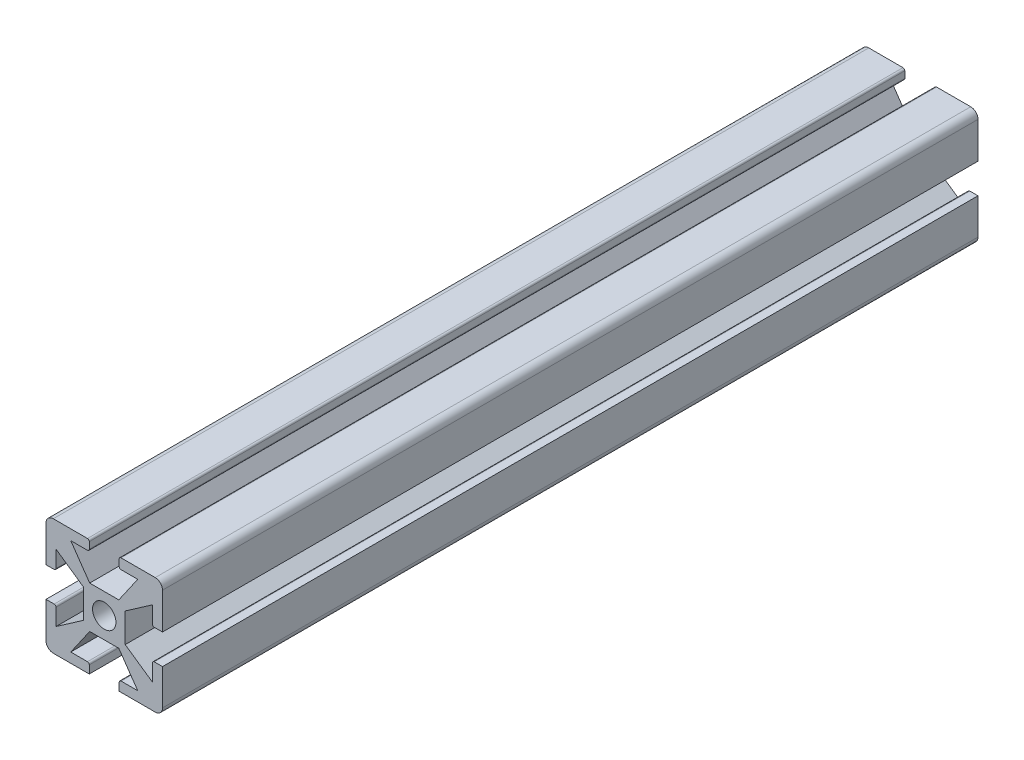
from build123d import *

# Parameters (mm, degrees)
SKETCH1_W           = 25.4
SKETCH1_H           = 25.4
BOSS_EXTRUDE1_DEPTH = 177.8
FILLET1_R           = 1.5875
HOLE1_OUTLINE_R     = 2.5527
HOLE1_DEPTH         = 177.8
SKETCH7_W           = 6.5278
SKETCH7_H           = 2.2352
CUT_EXTRUDE2_DEPTH  = 177.8
FILLET4_R           = 0.396875
CIRPATTERN2_DEPTH   = 177.8


# Read off the part's stored shape, not the designer's step: Hole1, CirPattern2
with BuildPart() as part:
    # Sketch1 → Boss-Extrude1 (new body)
    with BuildSketch(Plane.XY):
        Rectangle(SKETCH1_W, SKETCH1_H)
    extrude(amount=BOSS_EXTRUDE1_DEPTH)

    # Fillet1
    fillet1_edges = [part.edges().sort_by_distance(p)[0] for p in [
        (12.7, -12.7, 88.9),
        (-12.7, -12.7, 88.9),
        (-12.7, 12.7, 88.9),
        (12.7, 12.7, 88.9),
    ]]
    fillet(fillet1_edges, radius=FILLET1_R)

    # Hole1 outline → Hole1 (cut)
    with BuildSketch(Plane.XY):
        with Locations((0, -0.048792482)):
            Circle(HOLE1_OUTLINE_R)
    extrude(amount=HOLE1_DEPTH, mode=Mode.SUBTRACT)

    # Sketch7 → Cut-Extrude2 (cut)
    with BuildSketch(Plane.XY.offset(177.8)):
        with Locations((0, 11.5824)):
            Rectangle(SKETCH7_W, SKETCH7_H)
        Polygon((-3.175, 4.5212), (-7.3025, 10.4648), (7.3025, 10.4648), (3.175, 4.5212), align=None)
    extrude(amount=-CUT_EXTRUDE2_DEPTH, mode=Mode.SUBTRACT)

    # Fillet4
    fillet4_edges = [part.edges().sort_by_distance(p)[0] for p in [
        (-3.2639, 10.4648, 88.9),
        (-3.2639, 12.7, 88.9),
        (3.2639, 12.7, 88.9),
        (3.2639, 10.4648, 88.9),
    ]]
    fillet(fillet4_edges, radius=FILLET4_R)

    # CirPattern2 outline → CirPattern2 (cut)
    with BuildSketch(Plane.XY):
        with BuildLine():
            ThreePointArc((-3.660775, -10.562384964), (-3.380141996, -10.67862696), (-3.2639, -10.959259964))
            Line((-3.2639, -10.959259964), (-3.2639, -12.7))
            Line((-3.2639, -12.7), (3.2639, -12.7))
            Line((3.2639, -12.7), (3.2639, -10.959259964))
            ThreePointArc((3.2639, -10.959259964), (3.380141996, -10.67862696), (3.660775, -10.562384964))
            Line((3.660775, -10.562384964), (7.3025, -10.562384964))
            Line((7.3025, -10.562384964), (3.175, -4.618784964))
            Line((3.175, -4.618784964), (-3.175, -4.618784964))
            Line((-3.175, -4.618784964), (-7.3025, -10.562384964))
            Line((-7.3025, -10.562384964), (-3.660775, -10.562384964))
        make_face()
        with BuildLine():
            Line((-12.7, -3.312692482), (-10.910467482, -3.312692482))
            ThreePointArc((-10.910467482, -3.312692482), (-10.629834478, -3.428934478), (-10.513592482, -3.709567482))
            Line((-10.513592482, -3.709567482), (-10.513592482, -7.351292482))
            Line((-10.513592482, -7.351292482), (-4.569992482, -3.223792482))
            Line((-4.569992482, -3.223792482), (-4.569992482, 3.126207518))
            Line((-4.569992482, 3.126207518), (-10.513592482, 7.253707518))
            Line((-10.513592482, 7.253707518), (-10.513592482, 3.611982518))
            ThreePointArc((-10.513592482, 3.611982518), (-10.629834478, 3.331349514), (-10.910467482, 3.215107518))
            Line((-10.910467482, 3.215107518), (-12.7, 3.215107518))
            Line((-12.7, 3.215107518), (-12.7, -3.312692482))
        make_face()
        with BuildLine():
            ThreePointArc((10.513592482, -3.709567482), (10.629834478, -3.428934478), (10.910467482, -3.312692482))
            Line((10.910467482, -3.312692482), (12.7, -3.312692482))
            Line((12.7, -3.312692482), (12.7, 3.215107518))
            Line((12.7, 3.215107518), (10.910467482, 3.215107518))
            ThreePointArc((10.910467482, 3.215107518), (10.629834478, 3.331349514), (10.513592482, 3.611982518))
            Line((10.513592482, 3.611982518), (10.513592482, 7.253707518))
            Line((10.513592482, 7.253707518), (4.569992482, 3.126207518))
            Line((4.569992482, 3.126207518), (4.569992482, -3.223792482))
            Line((4.569992482, -3.223792482), (10.513592482, -7.351292482))
            Line((10.513592482, -7.351292482), (10.513592482, -3.709567482))
        make_face()
    extrude(amount=CIRPATTERN2_DEPTH, mode=Mode.SUBTRACT)


solid = part.part
